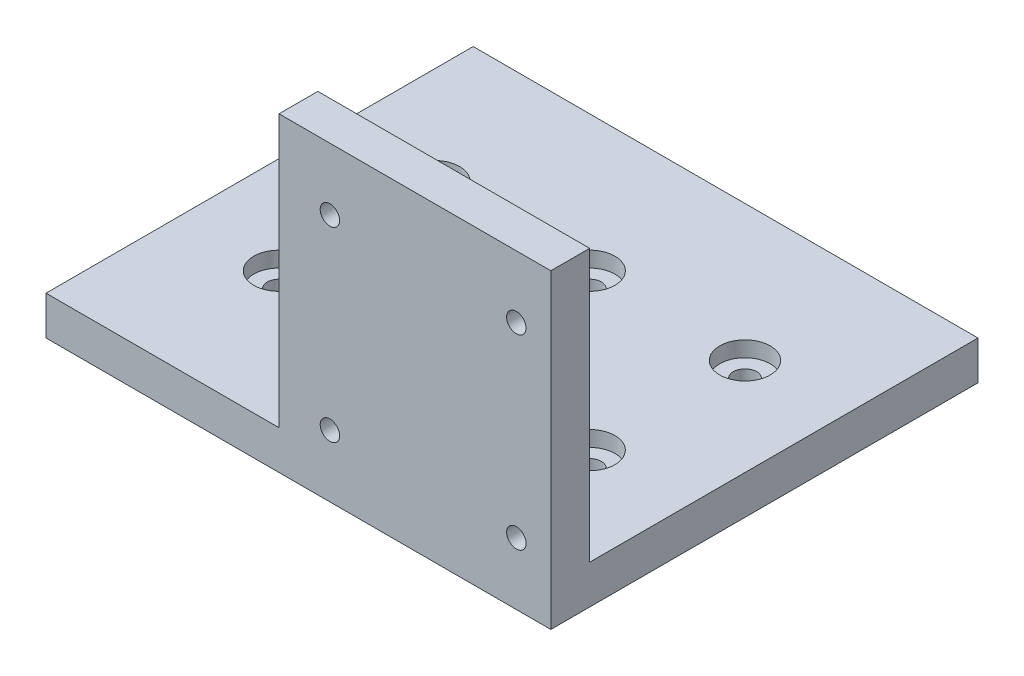
from build123d import *

# Parameters (mm, degrees)
SKETCH1_W            = 65
SKETCH1_H            = 55
BOSS_EXTRUDE1_DEPTH  = 5
SKETCH2_R            = 1.5
CUT_EXTRUDE1_DEPTH   = 5
SKETCH3_R            = 3.25
CUT_EXTRUDE2_DEPTH   = 2
LPATTERN1_COUNT      = 2
LPATTERN1_PITCH      = 20
LPATTERN1_COUNT_DIR2 = 3
LPATTERN1_PITCH_DIR2 = 20
SKETCH5_W            = 35
SKETCH5_H            = 5
BOSS_EXTRUDE2_DEPTH  = 35
SKETCH6_R            = 1.25
CUT_EXTRUDE3_DEPTH   = 35


with BuildPart() as part:
    # Sketch1 → Boss-Extrude1 (new body)
    with BuildSketch(Plane(origin=(0, 0, 0), x_dir=(1, 0, 0), z_dir=(0, 1, 0))):
        Rectangle(SKETCH1_W, SKETCH1_H)
    extrude(amount=BOSS_EXTRUDE1_DEPTH)

    # Sketch2 → Cut-Extrude1 (cut)
    with BuildSketch(Plane(origin=(0, 5, 0), x_dir=(1, 0, 0), z_dir=(0, 1, 0))):
        with Locations((-20, 10)):
            Circle(SKETCH2_R)
        with Locations((0, 10)):
            Circle(SKETCH2_R)
        with Locations((20, 10)):
            Circle(SKETCH2_R)
        with Locations((-20, -10)):
            Circle(SKETCH2_R)
        with Locations((0, -10)):
            Circle(SKETCH2_R)
        with Locations((20, -10)):
            Circle(SKETCH2_R)
    extrude(amount=-CUT_EXTRUDE1_DEPTH, mode=Mode.SUBTRACT)

    # Sketch3 → Cut-Extrude2 (cut)
    with BuildSketch(Plane(origin=(0, 5, 0), x_dir=(1, 0, 0), z_dir=(0, 1, 0))):
        with Locations((-20, 10)):
            Circle(SKETCH3_R)
    cut_extrude2 = extrude(amount=-CUT_EXTRUDE2_DEPTH, mode=Mode.SUBTRACT)

    # LPattern1: Cut-Extrude2 2 × 3
    with Locations(*[(j * LPATTERN1_PITCH_DIR2, 0, i * LPATTERN1_PITCH) for i in range(LPATTERN1_COUNT) for j in range(LPATTERN1_COUNT_DIR2) if (i, j) != (0, 0)]):
        add(cut_extrude2, mode=Mode.SUBTRACT)

    # Sketch5 → Boss-Extrude2 (add)
    with BuildSketch(Plane(origin=(0, 5, 0), x_dir=(1, 0, 0), z_dir=(0, 1, 0))):
        with Locations((15, -25)):
            Rectangle(SKETCH5_W, SKETCH5_H)
    extrude(amount=BOSS_EXTRUDE2_DEPTH)

    # Sketch6 → Cut-Extrude3 (cut)
    with BuildSketch(Plane.XY.offset(27.5)):
        with Locations((4.055342901, 32)):
            Circle(SKETCH6_R)
        with Locations((4.055342901, 8)):
            Circle(SKETCH6_R)
        with Locations((28.055342901, 32)):
            Circle(SKETCH6_R)
        with Locations((28.055342901, 8)):
            Circle(SKETCH6_R)
    extrude(amount=-CUT_EXTRUDE3_DEPTH, mode=Mode.SUBTRACT)


solid = part.part
